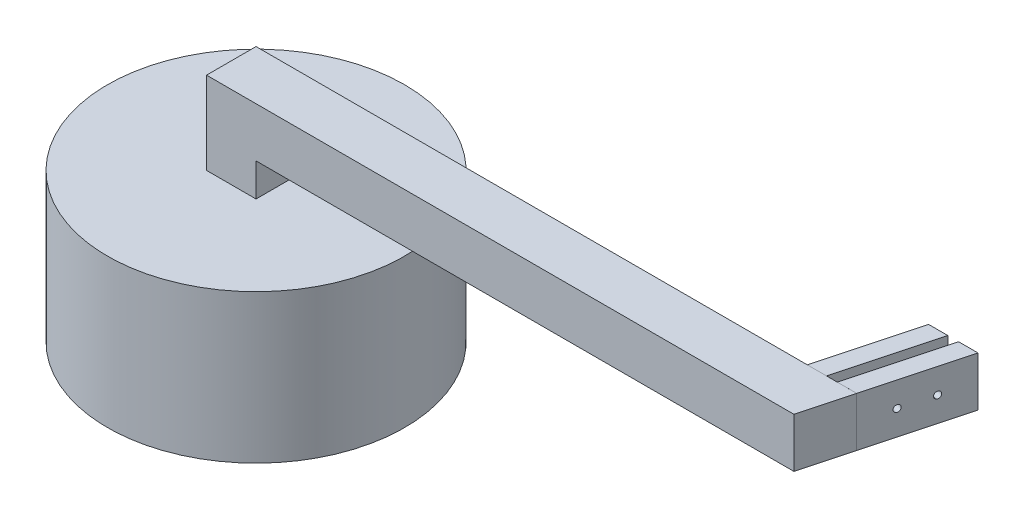
from build123d import *

# Parameters (mm, degrees)
SKETCH1_R                       = 90
BOSS_EXTRUDE1_DEPTH             = 90
SKETCH2_W                       = 30
SKETCH2_H                       = 30
BOSS_EXTRUDE2_DEPTH             = 50
SKETCH3_W                       = 30
SKETCH3_H                       = 30
BOSS_EXTRUDE3_DEPTH             = 120
BOSS_EXTRUDE4_START             = -30
BOSS_EXTRUDE4_DEPTH             = 30
BOSS_EXTRUDE5_START             = 110
BOSS_EXTRUDE5_DEPTH             = 30
CUT_EXTRUDE1_DEPTH              = 30
SKETCH8_W                       = 2.0193
SKETCH8_H                       = 443.424131357
F_10_32_TAPPED_HOLE1_AT_2_COUNT = 2
F_10_32_TAPPED_HOLE1_AT_2_PITCH = 20


# Read off the part's stored shape, not the designer's step: Boss-Extrude5
with BuildPart() as part:
    # Sketch1 → Boss-Extrude1 (new body)
    with BuildSketch(Plane(origin=(0, 0, 0), x_dir=(1, 0, 0), z_dir=(0, 1, 0))):
        with Locations(Location((0, 0, 0), (0, 0, 90))):
            Circle(SKETCH1_R)
    extrude(amount=BOSS_EXTRUDE1_DEPTH)

    # Sketch2 → Boss-Extrude2 (add)
    with BuildSketch(Plane(origin=(0, 90, 0), x_dir=(1, 0, 0), z_dir=(0, 1, 0))):
        Rectangle(SKETCH2_W, SKETCH2_H)
    extrude(amount=BOSS_EXTRUDE2_DEPTH)

    # Sketch3 → Boss-Extrude3 (add)
    with BuildSketch(Plane(origin=(15, 0, 0), x_dir=(0, 0, -1), z_dir=(1, 0, 0))):
        with Locations((0, 125)):
            Rectangle(SKETCH3_W, SKETCH3_H)
    extrude(amount=BOSS_EXTRUDE3_DEPTH)

    # Sketch4 → Boss-Extrude4 (add)
    with BuildSketch(Plane(origin=(0, 140, 0), x_dir=(1, 0, 0), z_dir=(0, 1, 0)).offset(BOSS_EXTRUDE4_START)):
        Polygon((348.970251581, 14.996296245), (340.932768226, -15), (135, -15), (135, 14.996296245), align=None)
    extrude(amount=BOSS_EXTRUDE4_DEPTH)


with BuildPart() as body_2:
    # Boss-Extrude5 outline → Boss-Extrude5 (new body)
    with BuildSketch(Plane(origin=(0, 0, 0), x_dir=(1, 0, 0), z_dir=(0, 1, 0)).offset(BOSS_EXTRUDE5_START)):
        Polygon((348.970251581, 15), (364.499394287, 72.955549577), (334.499394287, 72.955549577), (318.970251581, 15), align=None)
    extrude(amount=BOSS_EXTRUDE5_DEPTH)

    # Sketch6 → Cut-Extrude1 (cut)
    with BuildSketch(Plane(origin=(0, 140, 0), x_dir=(1, 0, 0), z_dir=(0, 1, 0))):
        Polygon((337.257253453, 15), (352.78639616, 72.955549577), (346.212392414, 72.955549577), (330.683249708, 15), align=None)
    extrude(amount=-CUT_EXTRUDE1_DEPTH, mode=Mode.SUBTRACT)


with BuildPart() as cut_extrude1_piece_1:
    # of the separate pieces the step leaves, piece 1, a body of its own (cut_extrude1_pieces)
    add(body_2.part.solids().sort_by_distance((348.970251581, 110, -15))[0])


with BuildPart() as cut_extrude1_piece_2:
    # of the separate pieces the step leaves, piece 2, a body of its own (cut_extrude1_pieces)
    add(body_2.part.solids().sort_by_distance((318.970251581, 110, -15))[0])


with BuildPart() as f_10_32_tapped_hole1_tool:
    # Sketch8 → #10-32 Tapped Hole1 (revolve)
    with BuildSketch(Plane(origin=(359.323013385, 125, -53.637033052), x_dir=(0.2588190451025241, 0, -0.9659258262890675), z_dir=(0, 1, 0))):
        with Locations((1.00965, 221.712065679)):
            Rectangle(SKETCH8_W, SKETCH8_H)
    f_10_32_tapped_hole1 = revolve(axis=Axis((365.456642382, 125, -51.993532115), (-0.9659258262890674, 0, -0.2588190451025241)))


with BuildPart() as cut_extrude1_piece_1_1:
    add(cut_extrude1_piece_1.part)

    # #10-32 Tapped Hole1: cut by f_10_32_tapped_hole1_tool
    add(f_10_32_tapped_hole1_tool.part, mode=Mode.SUBTRACT)


with BuildPart() as cut_extrude1_piece_2_1:
    add(cut_extrude1_piece_2.part)

    # #10-32 Tapped Hole1: cut by f_10_32_tapped_hole1_tool
    add(f_10_32_tapped_hole1_tool.part, mode=Mode.SUBTRACT)


with BuildPart() as f_10_32_tapped_hole1_at_2_tool:
    # #10-32 Tapped Hole1 at 2: #10-32 Tapped Hole1 ×2
    with Locations(*[Vector(-0.2588190451025241, 0, 0.9659258262890674) * (i * F_10_32_TAPPED_HOLE1_AT_2_PITCH) for i in range(1, F_10_32_TAPPED_HOLE1_AT_2_COUNT)]):
        add(f_10_32_tapped_hole1)


with BuildPart() as cut_extrude1_piece_1_2:
    add(cut_extrude1_piece_1_1.part)

    # #10-32 Tapped Hole1 at 2: cut by f_10_32_tapped_hole1_at_2_tool
    add(f_10_32_tapped_hole1_at_2_tool.part, mode=Mode.SUBTRACT)


with BuildPart() as cut_extrude1_piece_2_2:
    add(cut_extrude1_piece_2_1.part)

    # #10-32 Tapped Hole1 at 2: cut by f_10_32_tapped_hole1_at_2_tool
    add(f_10_32_tapped_hole1_at_2_tool.part, mode=Mode.SUBTRACT)


solid = Compound([part.part, cut_extrude1_piece_1_2.part, cut_extrude1_piece_2_2.part])
